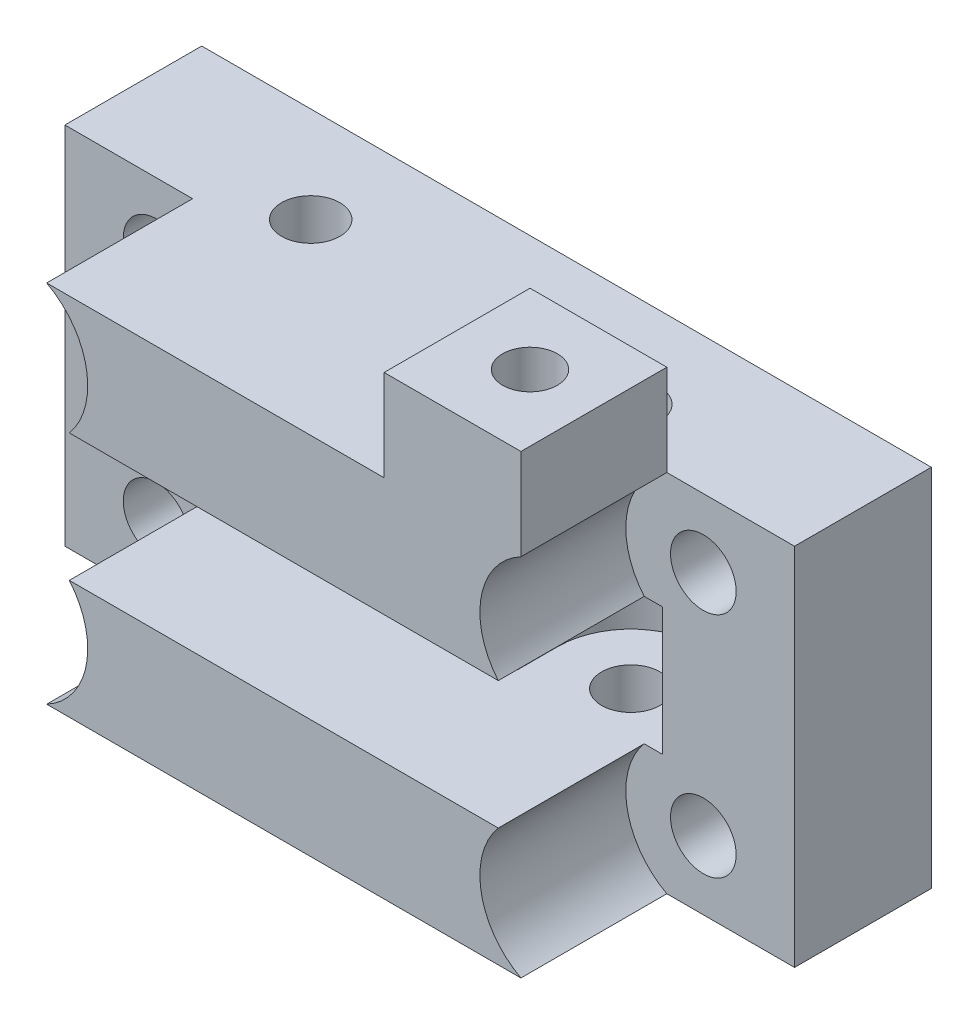
from build123d import *

# Parameters (mm, degrees)
SKETCH1_W               = 50.8
SKETCH1_H               = 25.4
BOSS_EXTRUDE1_DEPTH     = 4.7625
SKETCH2_R               = 2.286
CUT_EXTRUDE1_DEPTH      = 30.952890094
CUT_EXTRUDE2_DEPTH      = 4.445
SKETCH5_R               = 2.032
CUT_EXTRUDE3_DEPTH      = 37.235361268
BOSS_EXTRUDE2_DEPTH     = 10.16
MIRROR2_COPY_1_SKETCH_R = 2.286
MIRROR2_COPY_1_DEPTH    = 30.952890094
MIRROR2_COPY_2_DEPTH    = 10.16
MIRROR2_COPY_3_SKETCH_R = 2.286
MIRROR2_COPY_3_DEPTH    = 30.952890094
MIRROR2_COPY_4_DEPTH    = 10.16
SKETCH7_W               = 9.525
SKETCH7_H               = 10.16
BOSS_EXTRUDE3_DEPTH     = 6.35
SKETCH8_R               = 1.905
CUT_EXTRUDE4_DEPTH      = 6.35


with BuildPart() as part:
    # Sketch1 → Boss-Extrude1 (new, symmetric)
    with BuildSketch(Plane.XY):
        Rectangle(SKETCH1_W, SKETCH1_H)
    extrude(amount=BOSS_EXTRUDE1_DEPTH, both=True)

    # Sketch2 → Cut-Extrude1 (cut, through all)
    with BuildSketch(Plane.XY.offset(4.7625)):
        with Locations((-19.05, 7.9375)):
            Circle(SKETCH2_R)
    cut_extrude1 = extrude(amount=-CUT_EXTRUDE1_DEPTH, mode=Mode.SUBTRACT)

    # Sketch4 → Cut-Extrude2 (cut, symmetric)
    with BuildSketch(Plane(origin=(0, 0, 0), x_dir=(1, 0, 0), z_dir=(0, 1, 0))):
        with BuildLine():
            Line((-16.22425, -1.905), (-16.22425, -4.7625))
            Line((-16.22425, -4.7625), (-6.06425, -4.7625))
            Line((-6.06425, -4.7625), (-6.06425, -1.905))
            ThreePointArc((-6.06425, -1.905), (-11.14425, 3.175), (-16.22425, -1.905))
        make_face()
    cut_extrude2 = extrude(amount=CUT_EXTRUDE2_DEPTH, both=True, mode=Mode.SUBTRACT)

    # Sketch5 → Cut-Extrude3 (cut, through all)
    with BuildSketch(Plane(origin=(0, 12.7, 0), x_dir=(1, 0, 0), z_dir=(0, 1, 0))):
        with Locations((-11.14425, -1.905)):
            Circle(SKETCH5_R)
    cut_extrude3 = extrude(amount=-CUT_EXTRUDE3_DEPTH, mode=Mode.SUBTRACT)

    # Sketch6 → Boss-Extrude2 (add)
    with BuildSketch(Plane.XY.offset(4.7625)):
        with BuildLine():
            Line((-16.51, 12.7), (16.51, 12.7))
            ThreePointArc((16.51, 12.7), (13.748168987, 8.949228305), (14.934729657, 4.445))
            Line((14.934729657, 4.445), (-14.934729657, 4.445))
            ThreePointArc((-14.934729657, 4.445), (-13.748168987, 8.949228305), (-16.51, 12.7))
        make_face()
    boss_extrude2 = extrude(amount=BOSS_EXTRUDE2_DEPTH)

    # Mirror1: Cut-Extrude1, Boss-Extrude2 across plane
    add(cut_extrude1.mirror(Plane.ZX), mode=Mode.SUBTRACT)
    add(boss_extrude2.mirror(Plane.ZX))

    # Mirror2: Cut-Extrude2, Cut-Extrude3 across plane
    add(cut_extrude2.mirror(Plane(origin=(0, 0, 0), x_dir=(0, 0, 1), z_dir=(1, 0, 0))), mode=Mode.SUBTRACT)
    add(cut_extrude3.mirror(Plane(origin=(0, 0, 0), x_dir=(0, 0, 1), z_dir=(1, 0, 0))), mode=Mode.SUBTRACT)

    # Mirror2 copy 1 sketch → Mirror2 copy 1 (cut, through all)
    with BuildSketch(Plane(origin=(0, 0, 4.7625), x_dir=(-1, 0, 0), z_dir=(0, 0, 1))):
        with Locations((-19.05, 7.9375)):
            Circle(MIRROR2_COPY_1_SKETCH_R)
    extrude(amount=-MIRROR2_COPY_1_DEPTH, mode=Mode.SUBTRACT)

    # Mirror2 copy 2 sketch → Mirror2 copy 2 (add)
    with BuildSketch(Plane(origin=(0, 0, 4.7625), x_dir=(-1, 0, 0), z_dir=(0, 0, 1))):
        with BuildLine():
            Line((-16.51, 12.7), (16.51, 12.7))
            ThreePointArc((16.51, 12.7), (13.748168987, 8.949228305), (14.934729657, 4.445))
            Line((14.934729657, 4.445), (-14.934729657, 4.445))
            ThreePointArc((-14.934729657, 4.445), (-13.748168987, 8.949228305), (-16.51, 12.7))
        make_face()
    extrude(amount=MIRROR2_COPY_2_DEPTH)

    # Mirror2 copy 3 sketch → Mirror2 copy 3 (cut, through all)
    with BuildSketch(Plane(origin=(0, 0, 4.7625), x_dir=(-1, 0, 0), z_dir=(0, 0, 1))):
        with Locations((-19.05, -7.9375)):
            Circle(MIRROR2_COPY_3_SKETCH_R)
    extrude(amount=-MIRROR2_COPY_3_DEPTH, mode=Mode.SUBTRACT)

    # Mirror2 copy 4 sketch → Mirror2 copy 4 (add)
    with BuildSketch(Plane(origin=(0, 0, 4.7625), x_dir=(-1, 0, 0), z_dir=(0, 0, 1))):
        with BuildLine():
            Line((-16.51, -12.7), (16.51, -12.7))
            ThreePointArc((16.51, -12.7), (13.748168987, -8.949228305), (14.934729657, -4.445))
            Line((14.934729657, -4.445), (-14.934729657, -4.445))
            ThreePointArc((-14.934729657, -4.445), (-13.748168987, -8.949228305), (-16.51, -12.7))
        make_face()
    extrude(amount=MIRROR2_COPY_4_DEPTH)

    # Sketch7 → Boss-Extrude3 (add)
    with BuildSketch(Plane(origin=(0, 12.7, 0), x_dir=(1, 0, 0), z_dir=(0, 1, 0))):
        with Locations((11.7475, -9.8425)):
            Rectangle(SKETCH7_W, SKETCH7_H)
    extrude(amount=BOSS_EXTRUDE3_DEPTH)

    # Sketch8 → Cut-Extrude4 (cut)
    with BuildSketch(Plane(origin=(0, 19.05, 0), x_dir=(1, 0, 0), z_dir=(0, 1, 0))):
        with Locations((11.88669594, -9.667325107)):
            Circle(SKETCH8_R)
    extrude(amount=-CUT_EXTRUDE4_DEPTH, mode=Mode.SUBTRACT)


solid = part.part
